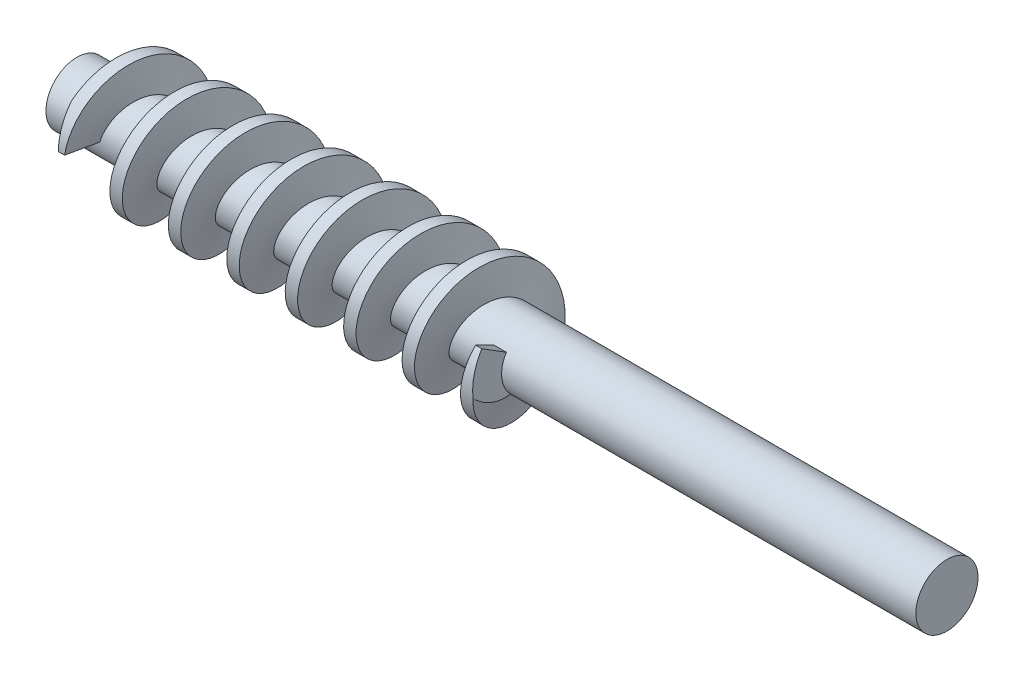
from build123d import *

# Parameters (mm, degrees)
SKETCH1_R                = 1.905
BOSS_EXTRUDE1_DEPTH      = 25.4
SWEEP1_PITCH             = 3.5829748
CUT_EXTRUDE1_START       = 0.443275045
CUT_EXTRUDE1_OUTLINE_W   = 2.6
CUT_EXTRUDE1_OUTLINE_H   = 6
CUT_EXTRUDE1_OUTLINE_W_2 = 2
CUT_EXTRUDE1_OUTLINE_H_2 = 3
CUT_EXTRUDE1_DEPTH       = 3.239725008
BOSS_EXTRUDE2_START      = -2.54
SKETCH8_R                = 1.905
BOSS_EXTRUDE2_DEPTH      = 2.54
SKETCH9_R                = 1.905
BOSS_EXTRUDE3_DEPTH      = 25.4


# Read off the part's stored shape, not the designer's step: Cut-Extrude1
with BuildPart() as part:
    # Sketch1 → Boss-Extrude1 (new body)
    with BuildSketch(Plane(origin=(0, 0, 0), x_dir=(0, 0, -1), z_dir=(1, 0, 0))):
        Circle(SKETCH1_R)
    extrude(amount=BOSS_EXTRUDE1_DEPTH)

    # Sweep1: the profile of Sketch6 profile screwed along a left-hand helix of 7.089081 turns, 12 arcs to a turn; built about Z, then put on its axis
    sweep1_z = Axis((0, 0, 0), (0, 0, 1))
    sweep1_corners = [(3.683, 0, -0.381), (3.683, 0, 0.381), (1.9047, 0, 0.762064286), (1.9047, 0, -0.762064286)]
    with BuildLine(mode=Mode.PRIVATE) as sweep1_profile:
        Line(sweep1_corners[0], sweep1_corners[1])
        Line(sweep1_corners[1], sweep1_corners[2])
        Line(sweep1_corners[2], sweep1_corners[3])
        Line(sweep1_corners[3], sweep1_corners[0])
    sweep1_cap = Face(sweep1_profile.wire())
    sweep1_turn_angles = [0, -15, -30, -45, -60, -75, -90, -105, -120, -135, -150, -165, -180, -195, -210, -225, -240, -255, -270, -285, -300, -315, -330, -345, -360]
    sweep1_turn_weights = [1, 0.9659258262890683, 1, 0.9659258262890683, 1, 0.9659258262890683, 1, 0.9659258262890683, 1, 0.9659258262890683, 1, 0.9659258262890683, 1, 0.9659258262890683, 1, 0.9659258262890683, 1, 0.9659258262890683, 1, 0.9659258262890683, 1, 0.9659258262890683, 1, 0.9659258262890683, 1]
    sweep1_turn_rails = [Edge.make_bspline([Vector(p[0], p[1], 0).rotate(sweep1_z, sweep1_turn_angles[k]) / sweep1_turn_weights[k] + Vector(0, 0, p[2] + -SWEEP1_PITCH * sweep1_turn_angles[k] / 360) for k in range(25)], [0, 0, 0, 1, 1, 2, 2, 3, 3, 4, 4, 5, 5, 6, 6, 7, 7, 8, 8, 9, 9, 10, 10, 11, 11, 12, 12, 12], 2, sweep1_turn_weights) for p in sweep1_corners]
    sweep1_turn_sides = [Face.make_surface_from_curves(sweep1_turn_rails[p[0]], sweep1_turn_rails[p[1]]) for p in [(0, 1), (1, 2), (2, 3), (3, 0)]]
    sweep1_last_angles = [-2520, -2535, -2550, -2551.03465143, -2552.06930286]
    sweep1_last_weights = [1, 0.9659258262890683, 1, 0.9998369574112642, 1]
    sweep1_last_rails = [Edge.make_bspline([Vector(p[0], p[1], 0).rotate(sweep1_z, sweep1_last_angles[k]) / sweep1_last_weights[k] + Vector(0, 0, p[2] + -SWEEP1_PITCH * sweep1_last_angles[k] / 360) for k in range(5)], [0, 0, 0, 1, 1, 2, 2, 2], 2, sweep1_last_weights) for p in sweep1_corners]
    sweep1_last_sides = [Face.make_surface_from_curves(sweep1_last_rails[p[0]], sweep1_last_rails[p[1]]) for p in [(0, 1), (1, 2), (2, 3), (3, 0)]]
    sweep1 = Plane(origin=(0, 0, 0), x_dir=(0, 0, 1), z_dir=(1, 0, 0)) * Solid(Shell([*[p.moved(Location((0, 0, SWEEP1_PITCH * i))) for i in range(7) for p in sweep1_turn_sides], *sweep1_last_sides, sweep1_cap, sweep1_cap.rotate(sweep1_z, -2552.06930286).moved(Location((0, 0, -SWEEP1_PITCH * -2552.06930286 / 360)))]))
    add(sweep1)

    # Cut-Extrude1 outline → Cut-Extrude1 (cut)
    with BuildSketch(Plane.XY.offset(CUT_EXTRUDE1_START)):
        with Locations((26.7, 0)):
            Rectangle(CUT_EXTRUDE1_OUTLINE_W, CUT_EXTRUDE1_OUTLINE_H)
        with Locations((-1, 1.5)):
            Rectangle(CUT_EXTRUDE1_OUTLINE_W_2, CUT_EXTRUDE1_OUTLINE_H_2)
    extrude(amount=CUT_EXTRUDE1_DEPTH, mode=Mode.SUBTRACT)

    # Sketch8 → Boss-Extrude2 (add)
    with BuildSketch(Plane(origin=(0, 0, 0), x_dir=(0, 0, -1), z_dir=(1, 0, 0)).offset(BOSS_EXTRUDE2_START)):
        with Locations(Location((0, 0, 0), (0, 0, 180))):
            Circle(SKETCH8_R)
    extrude(amount=BOSS_EXTRUDE2_DEPTH)

    # Sketch9 → Boss-Extrude3 (add)
    with BuildSketch(Plane(origin=(25.4, 0, 0), x_dir=(0, 0, -1), z_dir=(1, 0, 0))):
        Circle(SKETCH9_R)
    extrude(amount=BOSS_EXTRUDE3_DEPTH)


solid = part.part
